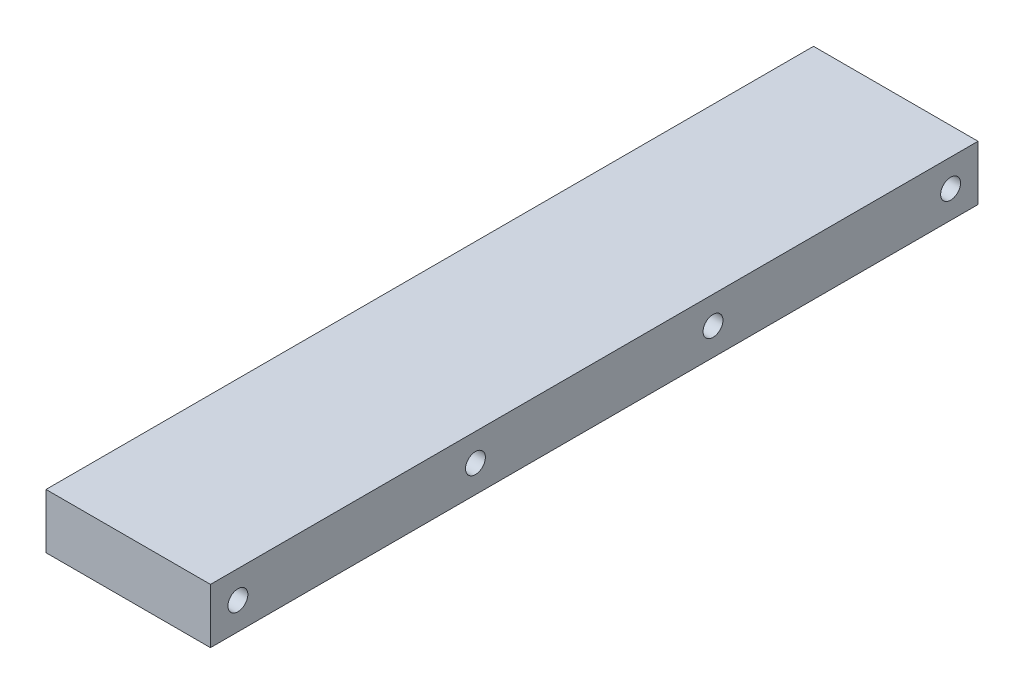
from build123d import *

# Parameters (mm, degrees)
SKETCH2_W           = 28.575
SKETCH2_H           = 133.35
BOSS_EXTRUDE1_DEPTH = 9.525
LPATTERN1_COUNT     = 4
LPATTERN1_PITCH     = 41.275
LPATTERN2_COUNT     = 4
LPATTERN2_PITCH     = 41.275


with BuildPart() as part:
    # Sketch2 → Boss-Extrude1 (new body)
    with BuildSketch(Plane(origin=(0, 0, 0), x_dir=(1, 0, 0), z_dir=(0, 1, 0))):
        with Locations((14.2875, 66.675)):
            Rectangle(SKETCH2_W, SKETCH2_H)
    extrude(amount=BOSS_EXTRUDE1_DEPTH)

    # Sketch5 → #5 Clearance Hole1 (revolve, cut)
    with BuildSketch(Plane(origin=(28.575, 4.7625, -4.7625), x_dir=(0, 0, -1), z_dir=(0, 1, 0))):
        Polygon((0, 0), (0, 13.737806461), (1.7272, 12.7), (1.7272, 0), align=None)
    f_5_clearance_hole1 = revolve(axis=Axis((34.925, 4.7625, -4.7625), (-1, 0, 0)), mode=Mode.SUBTRACT)

    # LPattern1: #5 Clearance Hole1 ×4
    with Locations(*[(0, 0, -i * LPATTERN1_PITCH) for i in range(1, LPATTERN1_COUNT)]):
        add(f_5_clearance_hole1, mode=Mode.SUBTRACT)

    # Sketch7 → #5 Clearance Hole2 (revolve, cut)
    with BuildSketch(Plane(origin=(0, 4.7625, -128.5875), x_dir=(0, 0, 1), z_dir=(0, 1, 0))):
        Polygon((0, 0), (0, 13.737806461), (1.7272, 12.7), (1.7272, 0), align=None)
    f_5_clearance_hole2 = revolve(axis=Axis((-6.35, 4.7625, -128.5875), (1, 0, 0)), mode=Mode.SUBTRACT)

    # LPattern2: #5 Clearance Hole2 ×4
    with Locations(*[(0, 0, i * LPATTERN2_PITCH) for i in range(1, LPATTERN2_COUNT)]):
        add(f_5_clearance_hole2, mode=Mode.SUBTRACT)


solid = part.part
